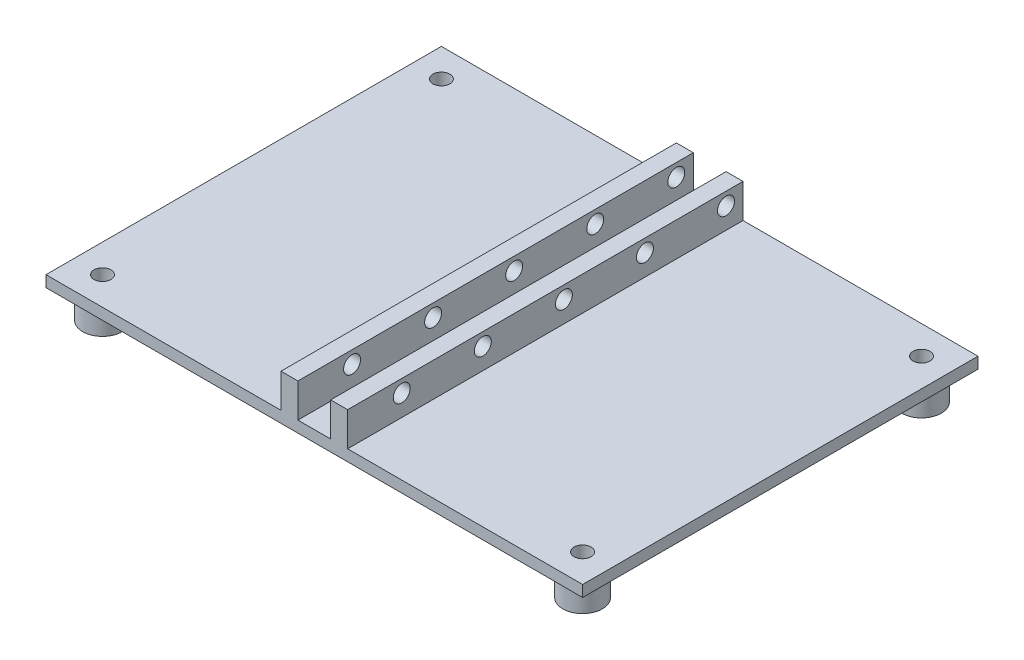
from build123d import *

# Parameters (mm, degrees)
SKETCH_1_W          = 95
SKETCH_1_H          = 70
SKETCH_1_R          = 1.5
EXTRUDE_1_DEPTH     = 2
SKETCH_2_W          = 3
SKETCH_2_H          = 70
EXTRUDE_2_DEPTH     = 6
SKETCH_3_R          = 1.5
CUT_EXTRUDE_1_DEPTH = 65.347183311
EXTRUDE_START       = 5
SKETCH_4_R          = 3.5
SKETCH_4_R_2        = 1.5
EXTRUDE_3_DEPTH     = 5


with BuildPart() as part:
    # 草图1 → 凸台-拉伸1 (new body)
    with BuildSketch(Plane(origin=(0, 0, 0), x_dir=(1, 0, 0), z_dir=(0, 1, 0))):
        Rectangle(SKETCH_1_W, SKETCH_1_H)
        with Locations((-42.5, 30)):
            Circle(SKETCH_1_R, mode=Mode.SUBTRACT)
        with Locations((42.5, 30)):
            Circle(SKETCH_1_R, mode=Mode.SUBTRACT)
        with Locations((-42.5, -30)):
            Circle(SKETCH_1_R, mode=Mode.SUBTRACT)
        with Locations((42.5, -30)):
            Circle(SKETCH_1_R, mode=Mode.SUBTRACT)
    extrude(amount=EXTRUDE_1_DEPTH)

    # 草图2 → 凸台-拉伸2 (add)
    with BuildSketch(Plane(origin=(0, 2, 0), x_dir=(1, 0, 0), z_dir=(0, 1, 0))):
        with Locations((-4.4, 0)):
            Rectangle(SKETCH_2_W, SKETCH_2_H)
        with Locations((4.4, 0)):
            Rectangle(SKETCH_2_W, SKETCH_2_H)
    extrude(amount=EXTRUDE_2_DEPTH)

    # 草图3 → 切除-拉伸1 (cut, through all)
    with BuildSketch(Plane.ZY.offset(5.9)):
        with Locations((-31.985850954, 5.75)):
            Circle(SKETCH_3_R)
        with Locations((-17.635850954, 5.75)):
            Circle(SKETCH_3_R)
        with Locations((-3.285850954, 5.75)):
            Circle(SKETCH_3_R)
        with Locations((11.064149046, 5.75)):
            Circle(SKETCH_3_R)
        with Locations((25.414149046, 5.75)):
            Circle(SKETCH_3_R)
    extrude(amount=-CUT_EXTRUDE_1_DEPTH, mode=Mode.SUBTRACT)

    # 草图4 → 凸台-拉伸3 (add)
    # profile 1 of 4: a face of its own
    with BuildSketch(Plane.XZ.offset(EXTRUDE_START)):
        with Locations((-42.5, -30)):
            Circle(SKETCH_4_R)
        with Locations((-42.5, -30)):
            Circle(SKETCH_4_R_2, mode=Mode.SUBTRACT)
    # profile 2 of 4: a face of its own
    with BuildSketch(Plane.XZ.offset(EXTRUDE_START)):
        with Locations((-42.5, 30)):
            Circle(SKETCH_4_R)
        with Locations((-42.5, 30)):
            Circle(SKETCH_4_R_2, mode=Mode.SUBTRACT)
    # profile 3 of 4: a face of its own
    with BuildSketch(Plane.XZ.offset(EXTRUDE_START)):
        with Locations((42.5, 30)):
            Circle(SKETCH_4_R)
        with Locations((42.5, 30)):
            Circle(SKETCH_4_R_2, mode=Mode.SUBTRACT)
    # profile 4 of 4: a face of its own
    with BuildSketch(Plane.XZ.offset(EXTRUDE_START)):
        with Locations((42.5, -30)):
            Circle(SKETCH_4_R)
        with Locations((42.5, -30)):
            Circle(SKETCH_4_R_2, mode=Mode.SUBTRACT)
    extrude(amount=-EXTRUDE_3_DEPTH)


solid = part.part
